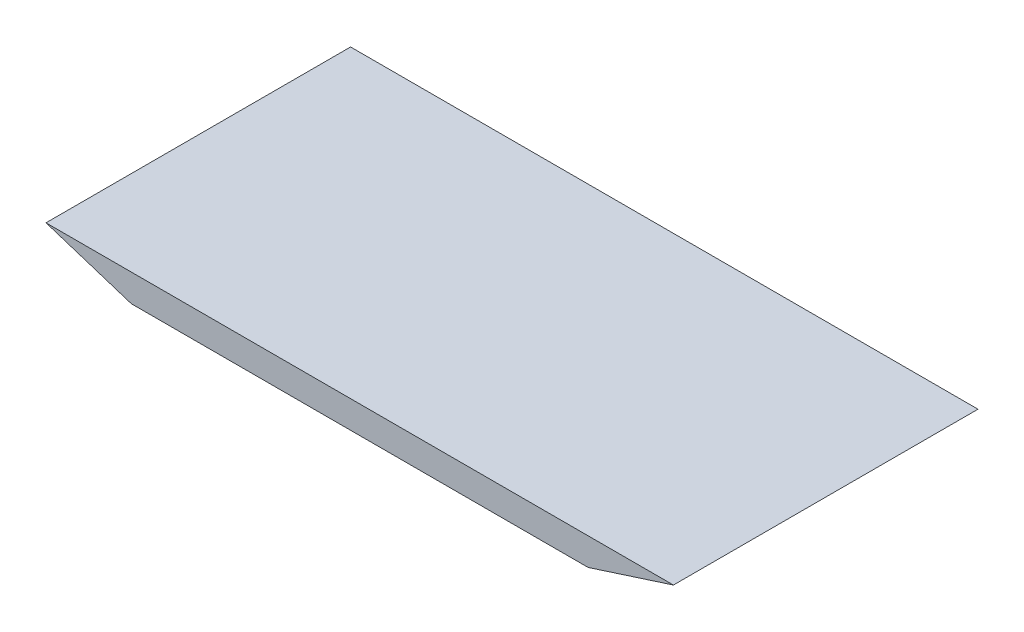
from build123d import *

# Parameters (mm, degrees)
BOSS_EXTRUDE1_DEPTH = 100


with BuildPart() as part:
    # Sketch1 → Boss-Extrude1 (new body)
    with BuildSketch(Plane.XY):
        Polygon((0, 0), (206, 0), (178, -9), (28, -9), align=None)
    extrude(amount=BOSS_EXTRUDE1_DEPTH)


solid = part.part
